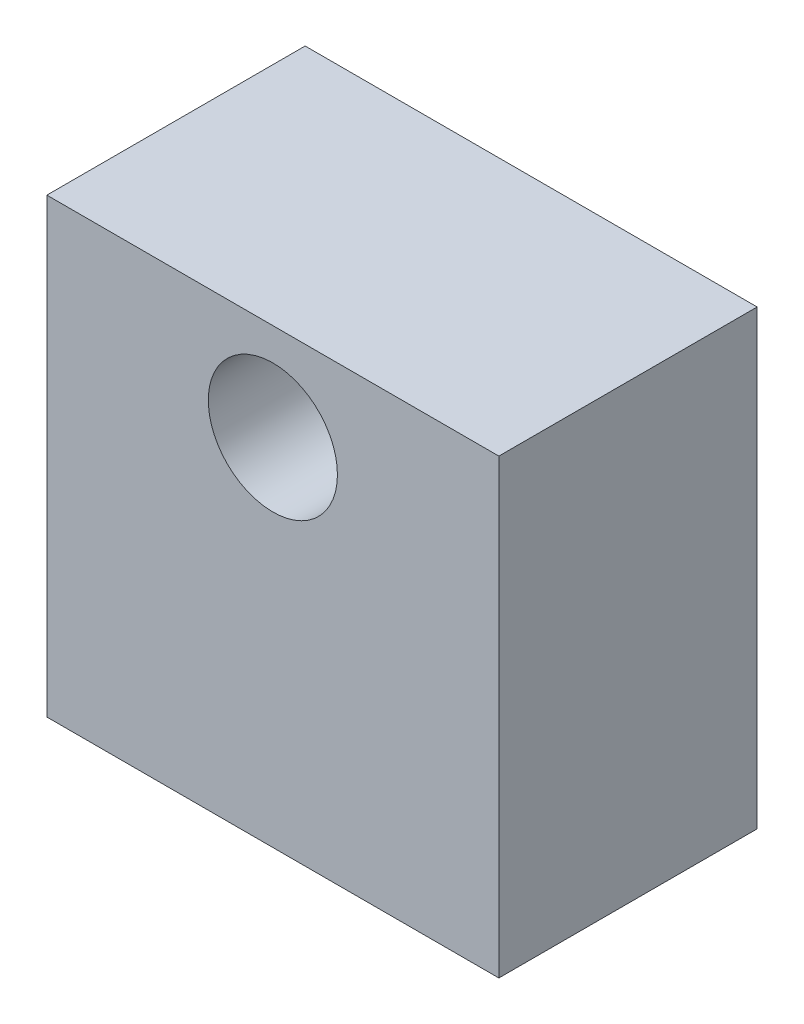
from build123d import *

# Parameters (mm, degrees)
SKETCH_1_W      = 70
SKETCH_1_H      = 70
SKETCH_1_R      = 10
EXTRUDE_1_DEPTH = 40


with BuildPart() as part:
    # Эскиз1 → Бобышка-Вытянуть1 (new body)
    with BuildSketch(Plane.XY):
        Rectangle(SKETCH_1_W, SKETCH_1_H)
        with Locations((0, 20)):
            Circle(SKETCH_1_R, mode=Mode.SUBTRACT)
    extrude(amount=EXTRUDE_1_DEPTH)


solid = part.part
